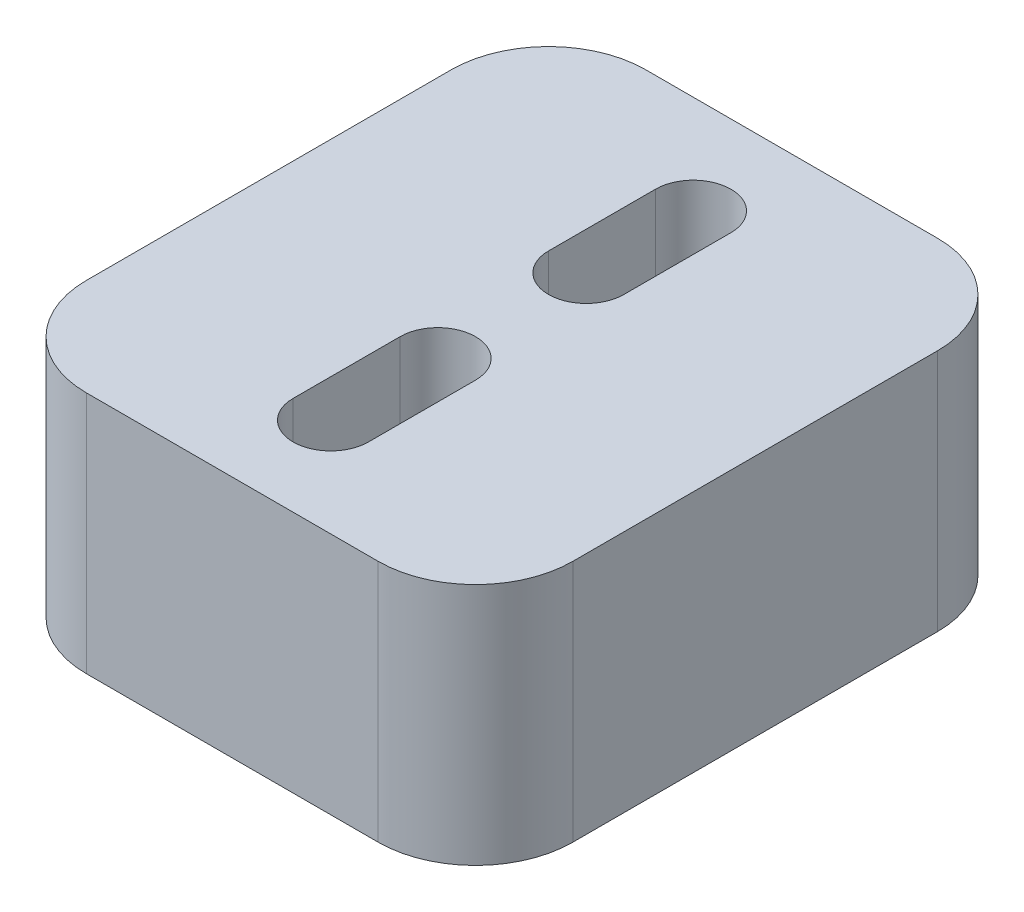
from build123d import *

# Parameters (mm, degrees)
SKETCH1_W           = 20
SKETCH1_H           = 23
BOSS_EXTRUDE1_DEPTH = 10
FILLET1_R           = 4


with BuildPart() as part:
    # Sketch1 → Boss-Extrude1 (new body)
    with BuildSketch(Plane(origin=(0, 0, 0), x_dir=(1, 0, 0), z_dir=(0, 1, 0))):
        Rectangle(SKETCH1_W, SKETCH1_H)
        with BuildLine():
            Line((1.55, 7.45), (1.55, 3.05))
            ThreePointArc((1.55, 3.05), (0, 1.5), (-1.55, 3.05))
            Line((-1.55, 3.05), (-1.55, 7.45))
            ThreePointArc((-1.55, 7.45), (0, 9), (1.55, 7.45))
        make_face(mode=Mode.SUBTRACT)
        with BuildLine():
            Line((1.55, -7.45), (1.55, -3.05))
            ThreePointArc((1.55, -3.05), (0, -1.5), (-1.55, -3.05))
            Line((-1.55, -3.05), (-1.55, -7.45))
            ThreePointArc((-1.55, -7.45), (0, -9), (1.55, -7.45))
        make_face(mode=Mode.SUBTRACT)
    extrude(amount=BOSS_EXTRUDE1_DEPTH)

    # Fillet1
    fillet1_edges = [part.edges().sort_by_distance(p)[0] for p in [
        (-10, 5, 11.5),
        (-10, 5, -11.5),
        (10, 5, -11.5),
        (10, 5, 11.5),
    ]]
    fillet(fillet1_edges, radius=FILLET1_R)


solid = part.part
